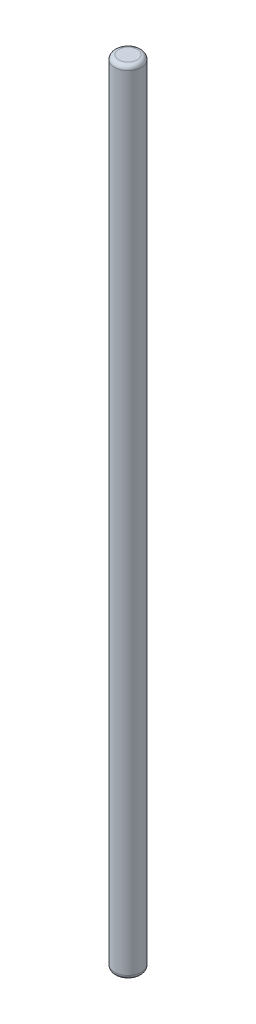
from build123d import *

# Parameters (mm, degrees)
SKETCH1_R           = 2.38125
BOSS_EXTRUDE1_DEPTH = 139.7
FILLET1_R           = 0.762


with BuildPart() as part:
    # Sketch1 → Boss-Extrude1 (new body)
    with BuildSketch(Plane(origin=(0, 0, 0), x_dir=(1, 0, 0), z_dir=(0, 1, 0))):
        Circle(SKETCH1_R)
    extrude(amount=BOSS_EXTRUDE1_DEPTH)

    # Fillet1
    fillet1_edges = [part.edges().sort_by_distance(p)[0] for p in [
        (-2.38125, 0, 0),
        (-2.38125, 139.7, 0),
    ]]
    fillet(fillet1_edges, radius=FILLET1_R)


solid = part.part
